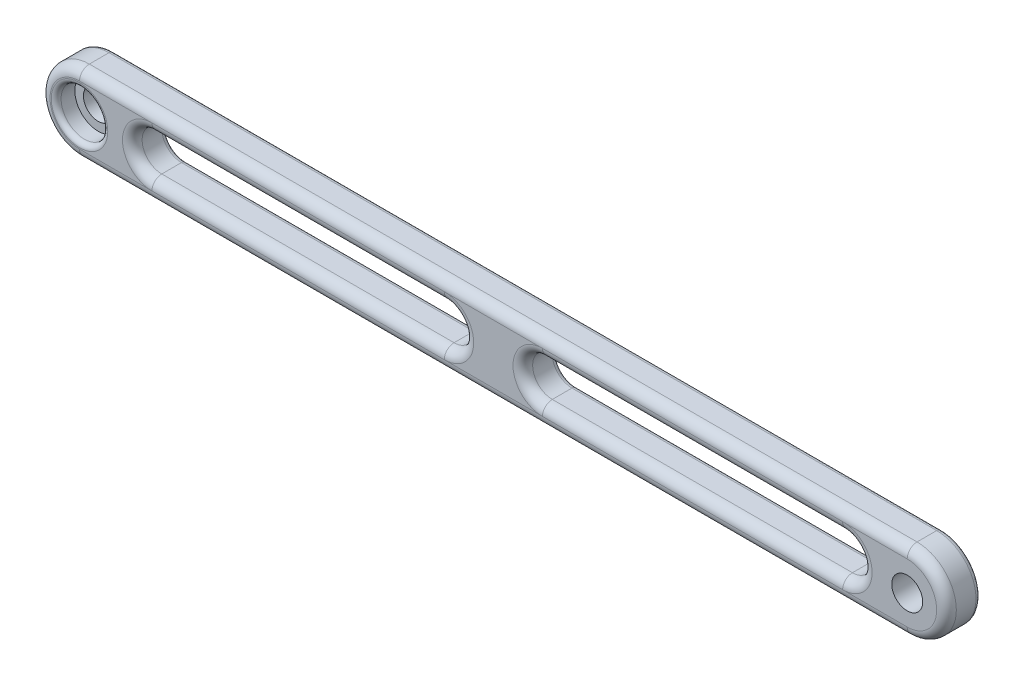
from build123d import *

# Parameters (mm, degrees)
SKETCH1_R           = 3.15
SKETCH1_R_2         = 3
BOSS_EXTRUDE1_DEPTH = 3.5
CUT_EXTRUDE1_START  = -0.3
SKETCH1_3_R         = 4.75
SKETCH1_3_R_2       = 3
CUT_EXTRUDE1_DEPTH  = 3.8
FILLET1_R           = 2
FILLET2_R           = 1
FILLET3_R           = 1
FILLET4_R           = 0.2


with BuildPart() as part:
    # Sketch1 → Boss-Extrude1 (new, symmetric)
    with BuildSketch(Plane.XY):
        with BuildLine():
            Line((-84.25, -8), (84.25, -8))
            ThreePointArc((84.25, -8), (92.25, 0), (84.25, 8))
            Line((84.25, 8), (-84.25, 8))
            ThreePointArc((-84.25, 8), (-92.25, 0), (-84.25, -8))
        make_face()
        with Locations((84.25, 0)):
            Circle(SKETCH1_R, mode=Mode.SUBTRACT)
        with Locations((-84.25, 0)):
            Circle(SKETCH1_R_2, mode=Mode.SUBTRACT)
        with BuildLine():
            Line((-69.5, 4), (-10, 4))
            ThreePointArc((-10, 4), (-6, 0), (-10, -4))
            Line((-10, -4), (-69.5, -4))
            ThreePointArc((-69.5, -4), (-73.5, 0), (-69.5, 4))
        make_face(mode=Mode.SUBTRACT)
        with BuildLine():
            Line((10, 4), (71.1, 4))
            ThreePointArc((71.1, 4), (75.1, 0), (71.1, -4))
            Line((71.1, -4), (10, -4))
            ThreePointArc((10, -4), (6, 0), (10, 4))
        make_face(mode=Mode.SUBTRACT)
    extrude(amount=BOSS_EXTRUDE1_DEPTH, both=True)

    # Sketch1<3> → Cut-Extrude1 (cut)
    with BuildSketch(Plane.XY.offset(CUT_EXTRUDE1_START)):
        with Locations((-84.25, 0)):
            Circle(SKETCH1_3_R)
        with Locations((-84.25, 0)):
            Circle(SKETCH1_3_R_2, mode=Mode.SUBTRACT)
    extrude(amount=CUT_EXTRUDE1_DEPTH, mode=Mode.SUBTRACT)

    # Fillet1
    fillet1_edges = [part.edges().sort_by_distance(p)[0] for p in [
        (40.55, -4, 3.5),
        (6, 0, 3.5),
        (40.55, 4, 3.5),
        (-6, 0, 3.5),
        (-39.75, -4, 3.5),
        (-73.5, 0, 3.5),
        (-39.75, 4, 3.5),
        (0, 8, 3.5),
        (-92.25, 0, 3.5),
        (0, -8, 3.5),
        (92.25, 0, 3.5),
        (75.1, 0, 3.5),
    ]]
    fillet(fillet1_edges, radius=FILLET1_R - 0.0001)  # a hair under: the kernel refuses the full size

    # Fillet2
    fillet2_edges = [part.edges().sort_by_distance(p)[0] for p in [
        (-89, 0, 3.5),
    ]]
    fillet(fillet2_edges, radius=FILLET2_R)

    # Fillet3
    fillet3_edges = [part.edges().sort_by_distance(p)[0] for p in [
        (92.25, 0, -3.5),
        (0, -8, -3.5),
        (-92.25, 0, -3.5),
        (0, 8, -3.5),
        (-39.75, 4, -3.5),
        (-73.5, 0, -3.5),
        (-39.75, -4, -3.5),
        (-6, 0, -3.5),
        (40.55, 4, -3.5),
        (6, 0, -3.5),
        (40.55, -4, -3.5),
        (75.1, 0, -3.5),
    ]]
    fillet(fillet3_edges, radius=FILLET3_R)

    # Fillet4
    fillet4_edges = [part.edges().sort_by_distance(p)[0] for p in [
        (-87.25, 0, -3.5),
        (81.1, 0, -3.5),
    ]]
    fillet(fillet4_edges, radius=FILLET4_R)


solid = part.part
